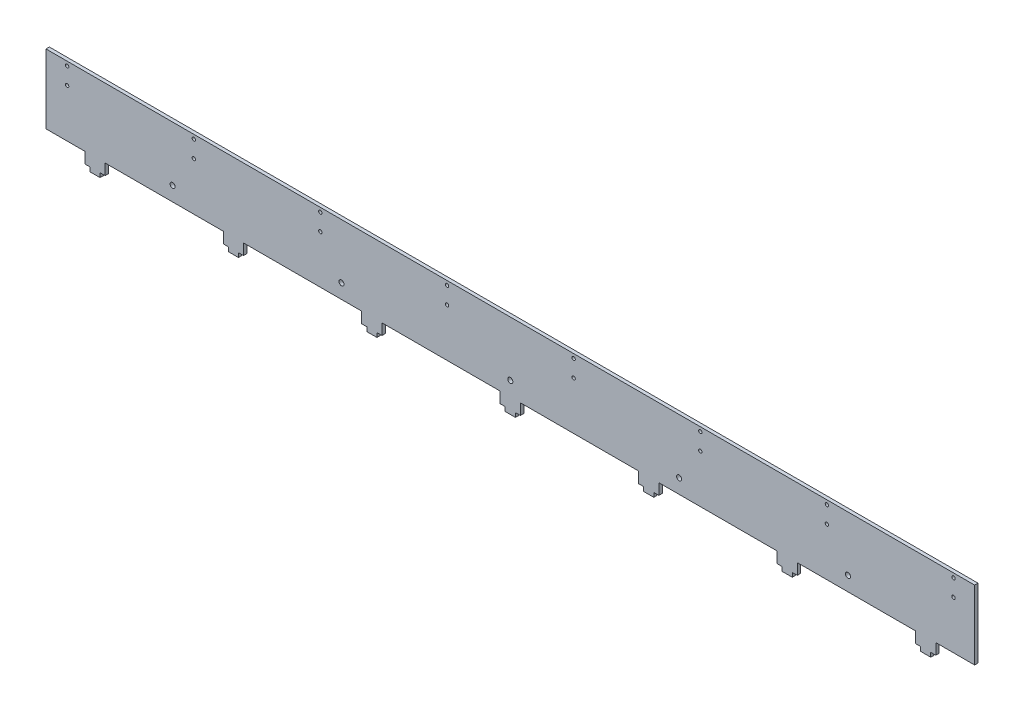
from build123d import *

# Parameters (mm, degrees)
SKETCH_1_W             = 1100
SKETCH_1_H             = 95
EXTRUDE_1_DEPTH        = 2
SKETCH_2_W             = 46
SKETCH_2_H             = 13
SKETCH_2_W_2           = 140
CUT_EXTRUDE_1_DEPTH    = 553.061817191
SKETCH_3_R             = 2
CUT_EXTRUDE_2_DEPTH    = 553.061817191
PATTERN_LINEAR_1_COUNT = 8
PATTERN_LINEAR_1_PITCH = 150
SKETCH_4_R             = 3
CUT_EXTRUDE_3_DEPTH    = 553.061817191
PATTERN_LINEAR_2_COUNT = 5
PATTERN_LINEAR_2_PITCH = 200
SKETCH_5_W             = 12
SKETCH_5_H             = 4
EXTRUDE_2_DEPTH        = 5


with BuildPart() as part:
    # Эскиз1 → Бобышка-Вытянуть1 (new, symmetric)
    with BuildSketch(Plane.XY):
        Rectangle(SKETCH_1_W, SKETCH_1_H)
    extrude(amount=EXTRUDE_1_DEPTH, both=True)

    # Эскиз2 → Вырез-Вытянуть1 (cut, through all)
    with BuildSketch(Plane.XY.offset(2)):
        with Locations((-527, -41)):
            Rectangle(SKETCH_2_W, SKETCH_2_H)
        with Locations((527, -41)):
            Rectangle(SKETCH_2_W, SKETCH_2_H)
        with Locations((-410, -41)):
            Rectangle(SKETCH_2_W_2, SKETCH_2_H)
        with Locations((-246, -41)):
            Rectangle(SKETCH_2_W_2, SKETCH_2_H)
        with Locations((-82, -41)):
            Rectangle(SKETCH_2_W_2, SKETCH_2_H)
        with Locations((82, -41)):
            Rectangle(SKETCH_2_W_2, SKETCH_2_H)
        with Locations((246, -41)):
            Rectangle(SKETCH_2_W_2, SKETCH_2_H)
        with Locations((410, -41)):
            Rectangle(SKETCH_2_W_2, SKETCH_2_H)
    extrude(amount=-CUT_EXTRUDE_1_DEPTH, mode=Mode.SUBTRACT)

    # Эскиз3 → Вырез-Вытянуть2 (cut, through all)
    with BuildSketch(Plane.XY.offset(2)):
        with Locations((-525, 42.5)):
            Circle(SKETCH_3_R)
        with Locations((-525, 22.5)):
            Circle(SKETCH_3_R)
    cut_extrude_2 = extrude(amount=-CUT_EXTRUDE_2_DEPTH, mode=Mode.SUBTRACT)

    # Линейный массив1: Вырез-Вытянуть2 ×8
    with Locations(*[(i * PATTERN_LINEAR_1_PITCH, 0, 0) for i in range(1, PATTERN_LINEAR_1_COUNT)]):
        add(cut_extrude_2, mode=Mode.SUBTRACT)

    # Эскиз4 → Вырез-Вытянуть3 (cut, through all)
    with BuildSketch(Plane(origin=(0, 0, -2), x_dir=(-1, 0, 0), z_dir=(0, 0, -1))):
        with Locations((-400, -17.5)):
            Circle(SKETCH_4_R)
    cut_extrude_3 = extrude(amount=-CUT_EXTRUDE_3_DEPTH, mode=Mode.SUBTRACT)

    # Линейный массив2: Вырез-Вытянуть3 ×5
    with Locations(*[(-i * PATTERN_LINEAR_2_PITCH, 0, 0) for i in range(1, PATTERN_LINEAR_2_COUNT)]):
        add(cut_extrude_3, mode=Mode.SUBTRACT)

    # Эскиз5 → Бобышка-Вытянуть2 (add)
    with BuildSketch(Plane.XZ.offset(47.5)):
        with Locations((492, 0)):
            Rectangle(SKETCH_5_W, SKETCH_5_H)
        with Locations((328, 0)):
            Rectangle(SKETCH_5_W, SKETCH_5_H)
        with Locations((164, 0)):
            Rectangle(SKETCH_5_W, SKETCH_5_H)
        Rectangle(SKETCH_5_W, SKETCH_5_H)
        with Locations((-492, 0)):
            Rectangle(SKETCH_5_W, SKETCH_5_H)
        with Locations((-328, 0)):
            Rectangle(SKETCH_5_W, SKETCH_5_H)
        with Locations((-164, 0)):
            Rectangle(SKETCH_5_W, SKETCH_5_H)
    extrude(amount=EXTRUDE_2_DEPTH)


solid = part.part
